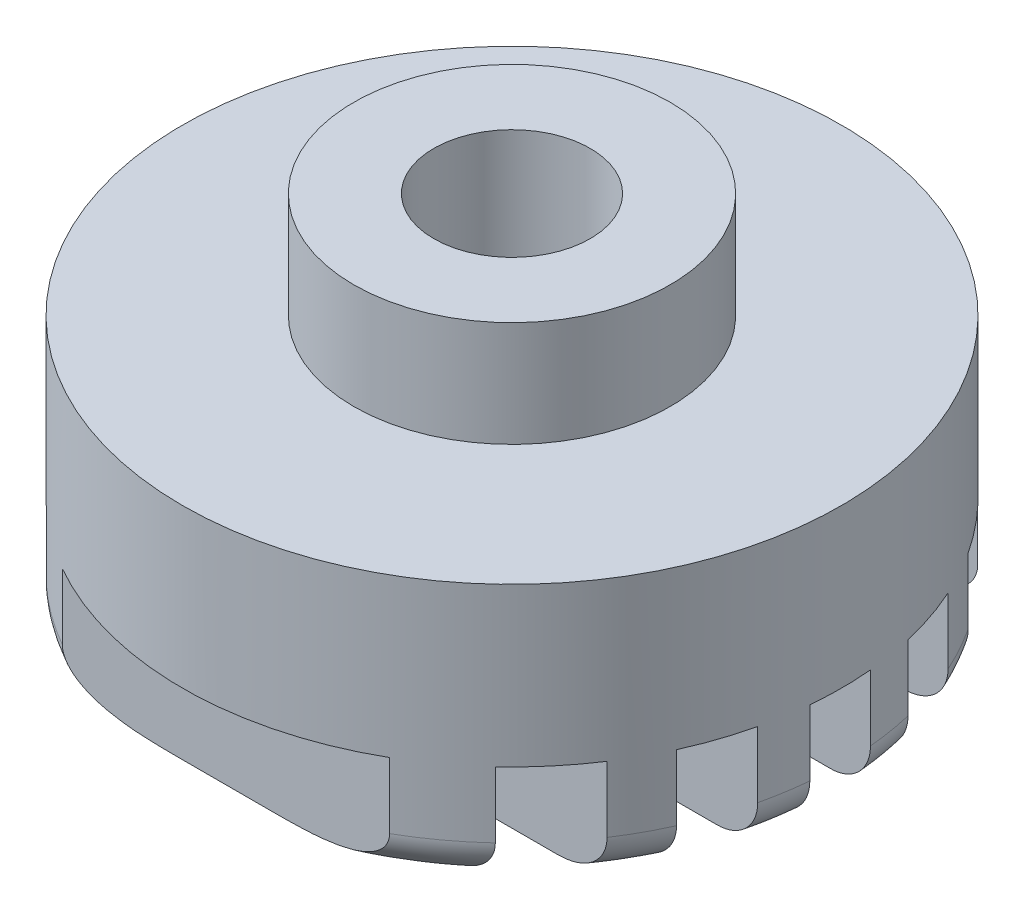
from build123d import *

# Parameters (mm, degrees)
SKETCH1_R             = 25
BOSS_EXTRUDE1_DEPTH   = 20
SKETCH14_W            = 53.859934174
SKETCH14_H            = 4.599425072
CUT_EXTRUDE13_DEPTH   = 8
LPATTERN11_COUNT      = 4
LPATTERN11_PITCH      = 8
LPATTERN11_COUNT_DIR2 = 4
LPATTERN11_PITCH_DIR2 = 8
SKETCH18_R            = 10.031636401
CUT_EXTRUDE15_DEPTH   = 8
SKETCH16_R            = 12
BOSS_EXTRUDE3_DEPTH   = 8
SKETCH19_R            = 5.934931829
CUT_EXTRUDE16_DEPTH   = 26
FILLET2_R             = 3
FILLET3_R             = 3


with BuildPart() as part:
    # Sketch1 → Boss-Extrude1 (new body)
    with BuildSketch(Plane(origin=(0, 0, 0), x_dir=(1, 0, 0), z_dir=(0, 1, 0))):
        Circle(SKETCH1_R)
    extrude(amount=BOSS_EXTRUDE1_DEPTH)

    # Sketch14 → Cut-Extrude13 (cut)
    with BuildSketch(Plane(origin=(0, 0, 0), x_dir=(1, 0, 0), z_dir=(0, 1, 0))):
        Rectangle(SKETCH14_W, SKETCH14_H)
    cut_extrude13 = extrude(amount=CUT_EXTRUDE13_DEPTH, mode=Mode.SUBTRACT)

    # LPattern11: Cut-Extrude13 4 × 4
    with Locations(*[Vector(0, 0, 1) * (i * LPATTERN11_PITCH) + Vector(0, 0, -1) * (j * LPATTERN11_PITCH_DIR2) for i in range(LPATTERN11_COUNT) for j in range(LPATTERN11_COUNT_DIR2) if (i, j) != (0, 0)]):
        add(cut_extrude13, mode=Mode.SUBTRACT)

    # Sketch18 → Cut-Extrude15 (cut)
    with BuildSketch(Plane.XZ):
        Circle(SKETCH18_R)
    extrude(amount=-CUT_EXTRUDE15_DEPTH, mode=Mode.SUBTRACT)

    # Sketch16 → Boss-Extrude3 (add)
    with BuildSketch(Plane(origin=(0, 20, 0), x_dir=(1, 0, 0), z_dir=(0, 1, 0))):
        Circle(SKETCH16_R)
    extrude(amount=BOSS_EXTRUDE3_DEPTH)

    # Sketch19 → Cut-Extrude16 (cut)
    with BuildSketch(Plane(origin=(0, 28, 0), x_dir=(1, 0, 0), z_dir=(0, 1, 0))):
        Circle(SKETCH19_R)
    extrude(amount=-CUT_EXTRUDE16_DEPTH, mode=Mode.SUBTRACT)

    # Fillet2
    fillet2_edges = [part.edges().sort_by_distance(p)[0] for p in [
        (-14.821115528, 0, 20.132921658),
    ]]
    fillet(fillet2_edges, radius=FILLET2_R)

    # Fillet3
    fillet3_edges = [part.edges().sort_by_distance(p)[0] for p in [
        (14.821115528, 0, -20.132921658),
        (21.911816104, 0, -12.036291581),
        (24.676378881, 0, -4.009529314),
        (24.676378881, 0, 4.009529314),
        (21.911816104, 0, 12.036291581),
        (14.821115528, 0, 20.132921658),
        (-14.821115528, 0, -20.132921658),
        (-21.911816104, 0, -12.036291581),
        (-24.676378881, 0, -4.009529314),
        (-24.676378881, 0, 4.009529314),
        (-21.911816104, 0, 12.036291581),
    ]]
    fillet(fillet3_edges, radius=FILLET3_R)


solid = part.part
